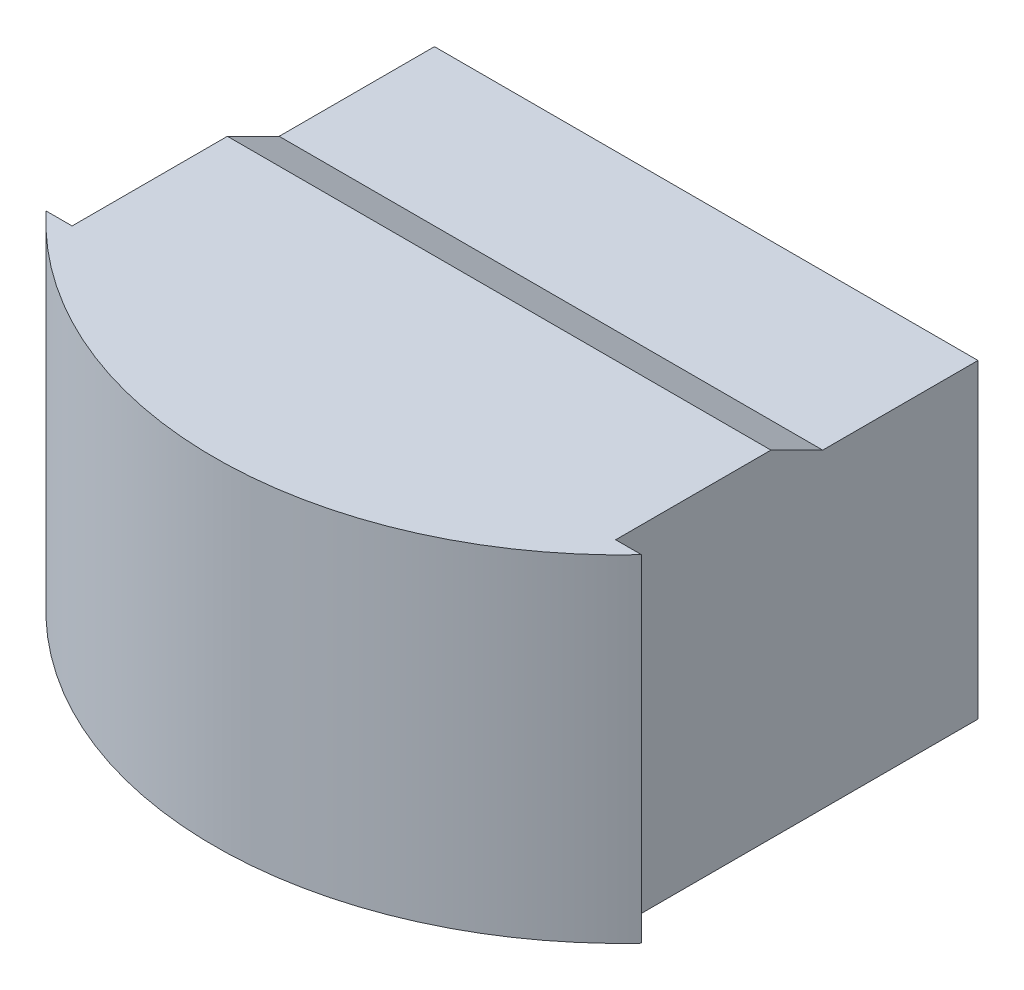
from build123d import *

# Parameters (mm, degrees)
BOSS_EXTRUDE2_DEPTH = 82.55
CUT_EXTRUDE4_DEPTH  = 186.023789011


with BuildPart() as part:
    # Sketch4 → Boss-Extrude2 (new body)
    with BuildSketch(Plane(origin=(0, 0, 0), x_dir=(1, 0, 0), z_dir=(0, 1, 0))):
        with BuildLine():
            Line((0, 0), (-6.35, 0))
            ThreePointArc((-6.35, 0), (66.675, -31.75), (139.7, 0))
            Line((139.7, 0), (133.35, 0))
            Line((133.35, 0), (133.35, 88.9))
            Line((133.35, 88.9), (0, 88.9))
            Line((0, 88.9), (0, 0))
        make_face()
    extrude(amount=BOSS_EXTRUDE2_DEPTH)

    # Sketch5 → Cut-Extrude4 (cut, through all)
    with BuildSketch(Plane(origin=(0, 0, 0), x_dir=(0, 0, -1), z_dir=(1, 0, 0))):
        Polygon((88.9, 82.55), (88.9, 76.2), (50.8, 76.2), (38.1, 82.55), align=None)
    extrude(amount=CUT_EXTRUDE4_DEPTH, mode=Mode.SUBTRACT)


solid = part.part
